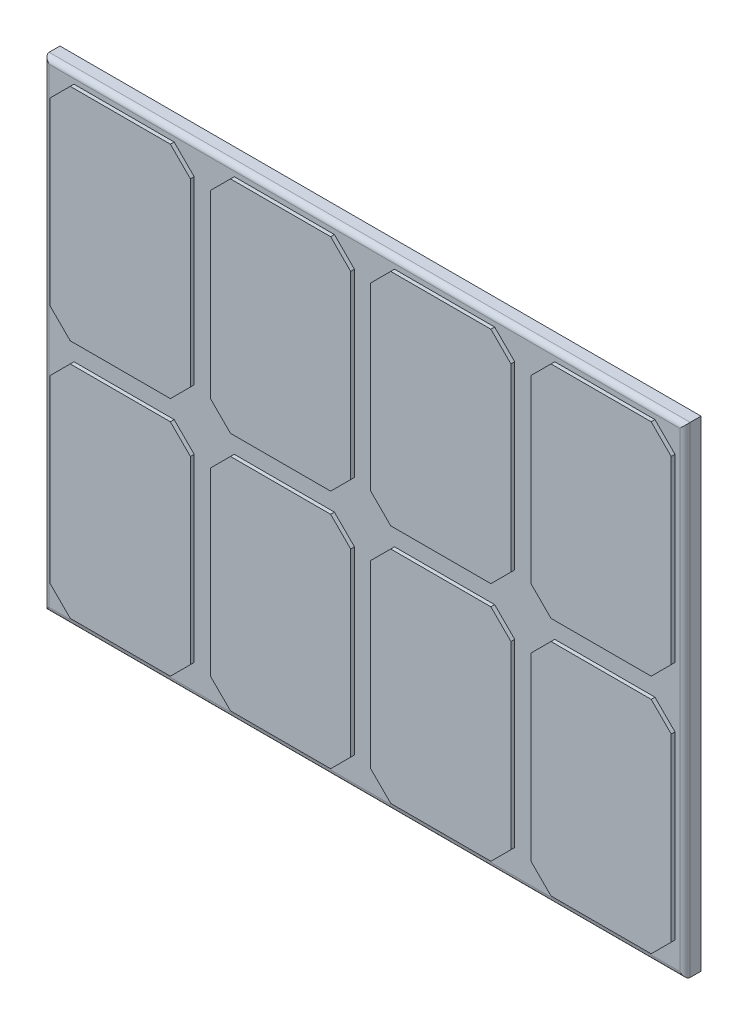
from build123d import *

# Parameters (mm, degrees)
SKETCH1_W           = 101.6
SKETCH1_H           = 76.2
BOSS_EXTRUDE1_DEPTH = 2.54
BOSS_EXTRUDE2_DEPTH = 0.5969
FILLET1_R           = 0.8255


with BuildPart() as part:
    # Sketch1 → Boss-Extrude1 (new body)
    with BuildSketch(Plane.XY):
        Rectangle(SKETCH1_W, SKETCH1_H)
    extrude(amount=BOSS_EXTRUDE1_DEPTH)

    # Sketch2 → Boss-Extrude2 (add)
    with BuildSketch(Plane.XY.offset(2.54)):
        Polygon((-46.0375, 36.5125), (-30.1625, 36.5125), (-26.9875, 33.3375), (-26.9875, 4.7625), (-30.1625, 1.5875), (-46.0375, 1.5875), (-49.2125, 4.7625), (-49.2125, 33.3375), align=None)
        Polygon((-23.8125, 33.3375), (-23.8125, 4.7625), (-20.6375, 1.5875), (-4.7625, 1.5875), (-1.5875, 4.7625), (-1.5875, 33.3375), (-4.7625, 36.5125), (-20.6375, 36.5125), align=None)
        Polygon((1.5875, 33.3375), (1.5875, 4.7625), (4.7625, 1.5875), (20.6375, 1.5875), (23.8125, 4.7625), (23.8125, 33.3375), (20.6375, 36.5125), (4.7625, 36.5125), align=None)
        Polygon((26.9875, 33.3375), (26.9875, 4.7625), (30.1625, 1.5875), (46.0375, 1.5875), (49.2125, 4.7625), (49.2125, 33.3375), (46.0375, 36.5125), (30.1625, 36.5125), align=None)
        Polygon((-23.8125, -4.7625), (-23.8125, -33.3375), (-20.6375, -36.5125), (-4.7625, -36.5125), (-1.5875, -33.3375), (-1.5875, -4.7625), (-4.7625, -1.5875), (-20.6375, -1.5875), align=None)
        Polygon((1.5875, -4.7625), (1.5875, -33.3375), (4.7625, -36.5125), (20.6375, -36.5125), (23.8125, -33.3375), (23.8125, -4.7625), (20.6375, -1.5875), (4.7625, -1.5875), align=None)
        Polygon((26.9875, -4.7625), (26.9875, -33.3375), (30.1625, -36.5125), (46.0375, -36.5125), (49.2125, -33.3375), (49.2125, -4.7625), (46.0375, -1.5875), (30.1625, -1.5875), align=None)
        Polygon((-49.2125, -4.7625), (-49.2125, -33.3375), (-46.0375, -36.5125), (-30.1625, -36.5125), (-26.9875, -33.3375), (-26.9875, -4.7625), (-30.1625, -1.5875), (-46.0375, -1.5875), align=None)
    extrude(amount=BOSS_EXTRUDE2_DEPTH)

    # Fillet1
    fillet1_edges = [part.edges().sort_by_distance(p)[0] for p in [
        (0, -38.1, 2.54),
        (50.8, 0, 2.54),
        (-50.8, 0, 2.54),
        (0, 38.1, 2.54),
    ]]
    fillet(fillet1_edges, radius=FILLET1_R)


solid = part.part
